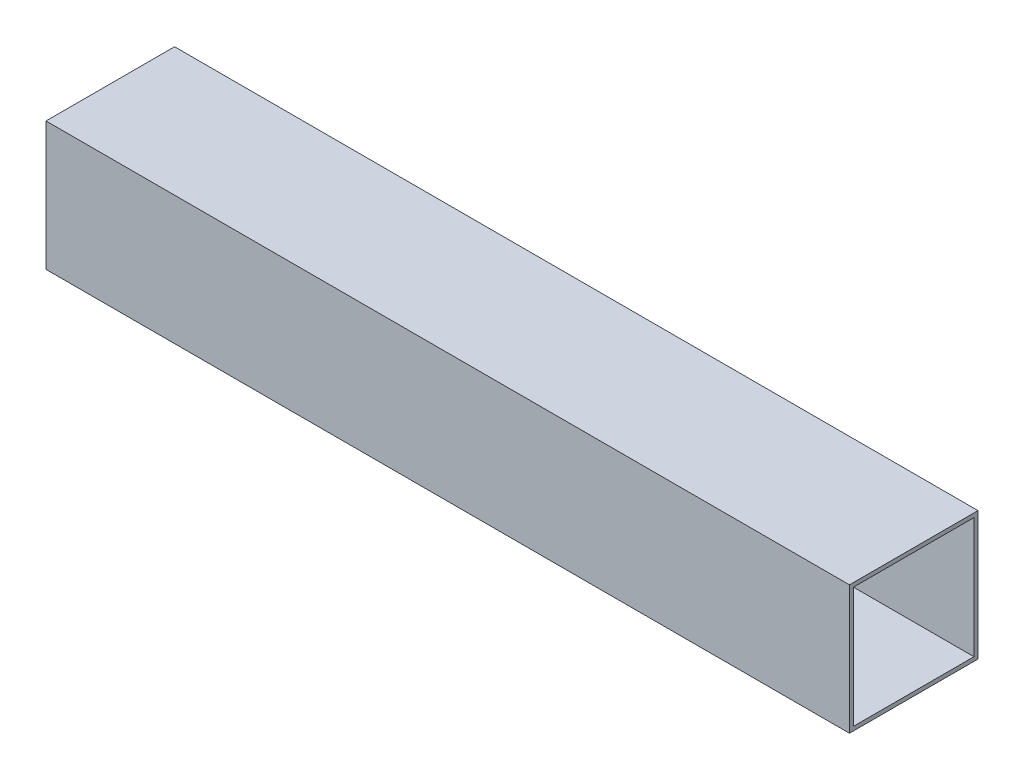
from build123d import *

# Parameters (mm, degrees)
SKETCH1_W           = 101.6
SKETCH1_H           = 101.6
SKETCH1_W_2         = 95.25
SKETCH1_H_2         = 95.25
BOSS_EXTRUDE1_DEPTH = 635


with BuildPart() as part:
    # Sketch1 → Boss-Extrude1 (new body)
    with BuildSketch(Plane(origin=(0, 0, 0), x_dir=(0, 0, -1), z_dir=(1, 0, 0))):
        with Locations((-50.8, 50.8)):
            Rectangle(SKETCH1_W, SKETCH1_H)
        with Locations((-50.8, 50.8)):
            Rectangle(SKETCH1_W_2, SKETCH1_H_2, mode=Mode.SUBTRACT)
    extrude(amount=BOSS_EXTRUDE1_DEPTH)


solid = part.part
